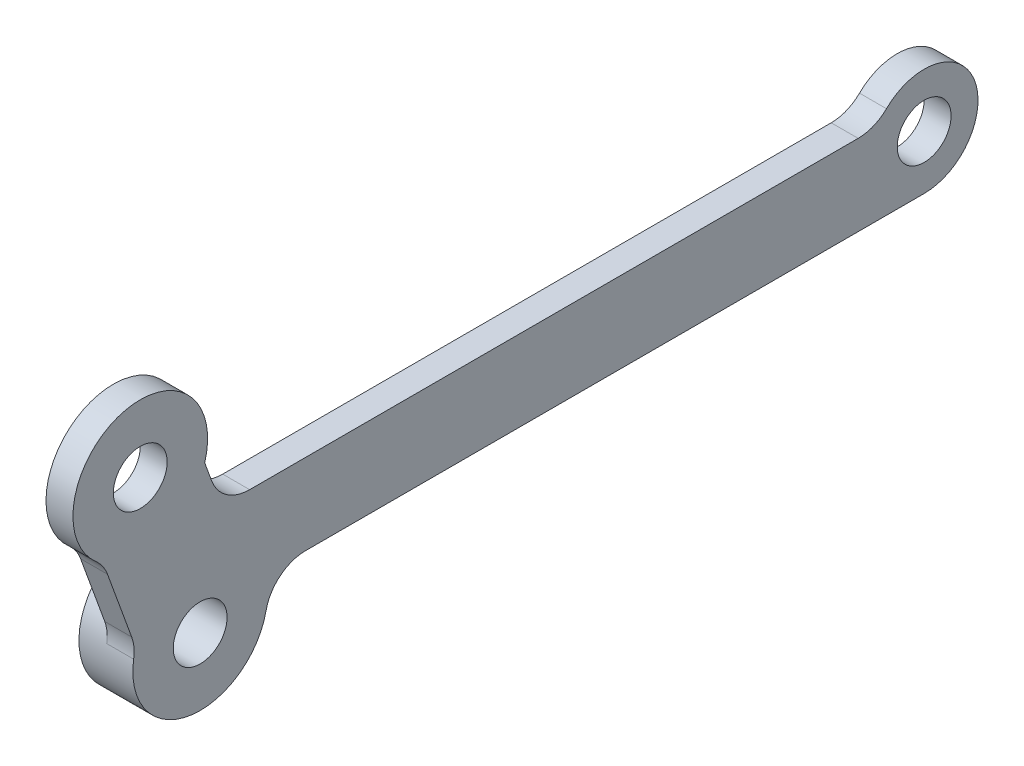
from build123d import *

# Parameters (mm, degrees)
EXTRUDE_1_DEPTH          = 2
EXTRUDE_START            = -2
SKETCH_1_4_R             = 5
EXTRUDE_2_DEPTH          = 2
CUT_EXTRUDE_1_DEPTH      = 58.563801167
CUT_EXTRUDE_1_DEPTH_BACK = 58.563801167
SKETCH_1_3_R             = 2
FILLET_1_R               = 3


with BuildPart() as part:
    # 草图1 → 凸台-拉伸1 (new body)
    with BuildSketch(Plane(origin=(0, 0, 0), x_dir=(0, 0, -1), z_dir=(1, 0, 0))):
        with BuildLine():
            Line((48.71971979, 0), (0, 0))
            Line((0, 0), (1.157760976, -3.180922138))
            ThreePointArc((1.157760976, -3.180922138), (2.450828184, -4.402761461), (3.234245818, -6))
            Line((3.234245818, -6), (52.183821406, -6))
            ThreePointArc((52.183821406, -6), (48.71971979, -4), (48.71971979, 0))
        make_face()
        with BuildLine():
            Line((1.157760976, -3.180922138), (0, 0))
            Line((0, 0), (-1.236380028, 3.396926208))
            ThreePointArc((-1.236380028, 3.396926208), (-4.311110224, 0.149460393), (-8.753920994, 0.660765061))
            Line((-8.753920994, 0.660765061), (-6.359779991, -5.917083284))
            ThreePointArc((-6.359779991, -5.917083284), (-3.285049794, -2.669617469), (1.157760976, -3.180922138))
        make_face()
        with BuildLine():
            ThreePointArc((56.183821406, -2), (53.219097586, 1.863703305), (48.71971979, 0))
            Line((48.71971979, 0), (52.183821406, 0))
            ThreePointArc((52.183821406, 0), (53.598034968, -0.585786438), (54.183821406, -2))
            ThreePointArc((54.183821406, -2), (53.598034968, -3.414213562), (52.183821406, -4))
            Line((52.183821406, -4), (52.183821406, -6))
            ThreePointArc((52.183821406, -6), (55.01224853, -4.828427125), (56.183821406, -2))
        make_face()
        with BuildLine():
            Line((52.183821406, 0), (48.71971979, 0))
            ThreePointArc((48.71971979, 0), (48.71971979, -4), (52.183821406, -6))
            Line((52.183821406, -6), (52.183821406, -4))
            ThreePointArc((52.183821406, -4), (50.183821406, -2), (52.183821406, 0))
        make_face()
        with BuildLine():
            ThreePointArc((3.234245818, -6), (2.450828184, -4.402761461), (1.157760976, -3.180922138))
            Line((1.157760976, -3.180922138), (2.183821406, -6))
            Line((2.183821406, -6), (3.234245818, -6))
        make_face()
        with BuildLine():
            Line((2.183821406, -6), (1.157760976, -3.180922138))
            ThreePointArc((1.157760976, -3.180922138), (-3.285049794, -2.669617469), (-6.359779991, -5.917083284))
            Line((-6.359779991, -5.917083284), (-5.333719561, -8.736161147))
            Line((-5.333719561, -8.736161147), (-3.454334319, -8.05212086))
            ThreePointArc((-3.454334319, -8.05212086), (-2.258989364, -5.488695332), (0.304436164, -6.684040287))
            Line((0.304436164, -6.684040287), (2.183821406, -6))
        make_face()
        with BuildLine():
            ThreePointArc((-8.753920994, 0.660765061), (-4.311110224, 0.149460393), (-1.236380028, 3.396926208))
            Line((-1.236380028, 3.396926208), (-2.262440458, 6.21600407))
            Line((-2.262440458, 6.21600407), (-4.141825699, 5.531963784))
            ThreePointArc((-4.141825699, 5.531963784), (-4.051595435, 5.195219852), (-4.021210941, 4.847923497))
            ThreePointArc((-4.021210941, 4.847923497), (-5.673914585, 2.878307991), (-7.900596182, 4.16388321))
            Line((-7.900596182, 4.16388321), (-9.779981424, 3.479842924))
            Line((-9.779981424, 3.479842924), (-8.753920994, 0.660765061))
        make_face()
        with BuildLine():
            Line((-2.262440458, 6.21600407), (-1.236380028, 3.396926208))
            ThreePointArc((-1.236380028, 3.396926208), (-1.075295729, 4.114491348), (-1.021210941, 4.847923497))
            ThreePointArc((-1.021210941, 4.847923497), (-8.402014349, 9.244714956), (-8.753920994, 0.660765061))
            Line((-8.753920994, 0.660765061), (-9.779981424, 3.479842924))
            Line((-9.779981424, 3.479842924), (-7.900596182, 4.16388321))
            ThreePointArc((-7.900596182, 4.16388321), (-6.705251227, 6.727308738), (-4.141825699, 5.531963784))
            Line((-4.141825699, 5.531963784), (-2.262440458, 6.21600407))
        make_face()
        with BuildLine():
            ThreePointArc((54.183821406, -2), (53.598034968, -0.585786438), (52.183821406, 0))
            Line((52.183821406, 0), (52.183821406, -4))
            ThreePointArc((52.183821406, -4), (53.598034968, -3.414213562), (54.183821406, -2))
        make_face()
        with BuildLine():
            Line((52.183821406, -4), (52.183821406, 0))
            ThreePointArc((52.183821406, 0), (50.183821406, -2), (52.183821406, -4))
        make_face()
        with BuildLine():
            Line((3.234245818, -6), (2.183821406, -6))
            Line((2.183821406, -6), (0.304436164, -6.684040287))
            ThreePointArc((0.304436164, -6.684040287), (0.394666428, -7.020784218), (0.425050922, -7.368080573))
            ThreePointArc((0.425050922, -7.368080573), (-1.227652722, -9.337696079), (-3.454334319, -8.05212086))
            Line((-3.454334319, -8.05212086), (-5.333719561, -8.736161147))
            Line((-5.333719561, -8.736161147), (-6.359779991, -5.917083284))
            ThreePointArc((-6.359779991, -5.917083284), (-2.308381227, -12.313995785), (3.425050922, -7.368080573))
            ThreePointArc((3.425050922, -7.368080573), (3.377119908, -6.677419469), (3.234245818, -6))
        make_face()
        with BuildLine():
            ThreePointArc((0.425050922, -7.368080573), (0.394666428, -7.020784218), (0.304436164, -6.684040287))
            Line((0.304436164, -6.684040287), (-3.454334319, -8.05212086))
            ThreePointArc((-3.454334319, -8.05212086), (-1.227652722, -9.337696079), (0.425050922, -7.368080573))
        make_face()
        with BuildLine():
            Line((-3.454334319, -8.05212086), (0.304436164, -6.684040287))
            ThreePointArc((0.304436164, -6.684040287), (-2.258989364, -5.488695332), (-3.454334319, -8.05212086))
        make_face()
        with BuildLine():
            ThreePointArc((-4.021210941, 4.847923497), (-4.051595435, 5.195219852), (-4.141825699, 5.531963784))
            Line((-4.141825699, 5.531963784), (-7.900596182, 4.16388321))
            ThreePointArc((-7.900596182, 4.16388321), (-5.673914585, 2.878307991), (-4.021210941, 4.847923497))
        make_face()
        with BuildLine():
            Line((-7.900596182, 4.16388321), (-4.141825699, 5.531963784))
            ThreePointArc((-4.141825699, 5.531963784), (-6.705251227, 6.727308738), (-7.900596182, 4.16388321))
        make_face()
    extrude(amount=EXTRUDE_1_DEPTH)

    # 草图1<4> → 凸台-拉伸2 (add)
    with BuildSketch(Plane(origin=(0, 0, 0), x_dir=(0, 0, -1), z_dir=(1, 0, 0)).offset(EXTRUDE_START)):
        with Locations(Location((-1.574949078, -7.368080573, 0), (0, 0, 163.130102354))):
            Circle(SKETCH_1_4_R)
    extrude(amount=EXTRUDE_2_DEPTH)

    # 草图1<3> → 切除-拉伸1 (cut, two sides: drawn at the far end of the back side and taken through both)
    with BuildSketch(Plane(origin=(0, 0, 0), x_dir=(0, 0, -1), z_dir=(1, 0, 0)).offset(-CUT_EXTRUDE_1_DEPTH_BACK)):
        with Locations((-6.021210941, 4.847923497)):
            Circle(SKETCH_1_3_R)
        with Locations((52.183821406, -2)):
            Circle(SKETCH_1_3_R)
        with Locations((-1.574949078, -7.368080573)):
            Circle(SKETCH_1_3_R)
    extrude(amount=CUT_EXTRUDE_1_DEPTH + CUT_EXTRUDE_1_DEPTH_BACK, mode=Mode.SUBTRACT)

    # 圆角1
    # the kernel refuses this fillet: 3 mm, written as the material it adds along each edge
    with BuildSketch(Plane(origin=(0, -6, -3.234245818), x_dir=(0, 0, -1), z_dir=(1, 0, 0))) as fillet_1_piece_1:
        with BuildLine():
            CenterArc((3.022589, -3), FILLET_1_R, 90, 78.229623191)
            ThreePointArc((0.085670039, -2.388030215), (0.187590709, -1.18882203), (0, 0))
            Line((0, 0), (3.022589, 0))
        make_face()
    extrude(amount=2)
    with BuildSketch(Plane(origin=(0, 0, 0), x_dir=(0, 0, -1), z_dir=(1, 0, 0))) as fillet_1_piece_2:
        with BuildLine():
            CenterArc((FILLET_1_R * 0.70020753821, FILLET_1_R), FILLET_1_R, 200, 70)
            Line((-FILLET_1_R * 0.239485082576, FILLET_1_R * 0.657979856674), (0, 0))
            Line((0, 0), (FILLET_1_R * 0.70020753821, 0))
        make_face()
    extrude(amount=2)
    with BuildSketch(Plane(origin=(0, 0, -48.71971979), x_dir=(0, 0, 1), z_dir=(1, 0, 0))) as fillet_1_piece_3:
        with BuildLine():
            CenterArc((1.43487787, -3), FILLET_1_R, 90, 44.415308597)
            ThreePointArc((-0.664684766, -0.857142857), (-0.303154074, -0.451205957), (0, 0))
            Line((0, 0), (1.43487787, 0))
        make_face()
    extrude(amount=2)
    with BuildSketch(Plane(origin=(0, 0.660765061, 8.753920994), x_dir=(0, 0.6030345104353418, 0.7977150990322344), z_dir=(1, 0, 0))) as fillet_1_piece_4:
        with BuildLine():
            CenterArc((0.897200113, 2.992846785), FILLET_1_R, 237.087538991, 28.955024372)
            Line((-0.732871014, 0.474341649), (0, 0))
            ThreePointArc((0, 0), (0.345076967, 0.011922025), (0.690153933, 0))
        make_face()
    extrude(amount=2)
    with BuildSketch(Plane(origin=(0, -5.917083284, 6.359779991), x_dir=(0, -0.974712617445799, 0.2234621072843435), z_dir=(1, 0, 0))) as fillet_1_piece_5:
        with BuildLine():
            CenterArc((0.897200113, -2.992846785), FILLET_1_R, 93.957436637, 28.955024372)
            Line((-0.732871014, -0.474341649), (0, 0))
            ThreePointArc((0, 0), (0.345076967, -0.011922025), (0.690153933, 0))
        make_face()
    extrude(amount=2)


solid = part.part
